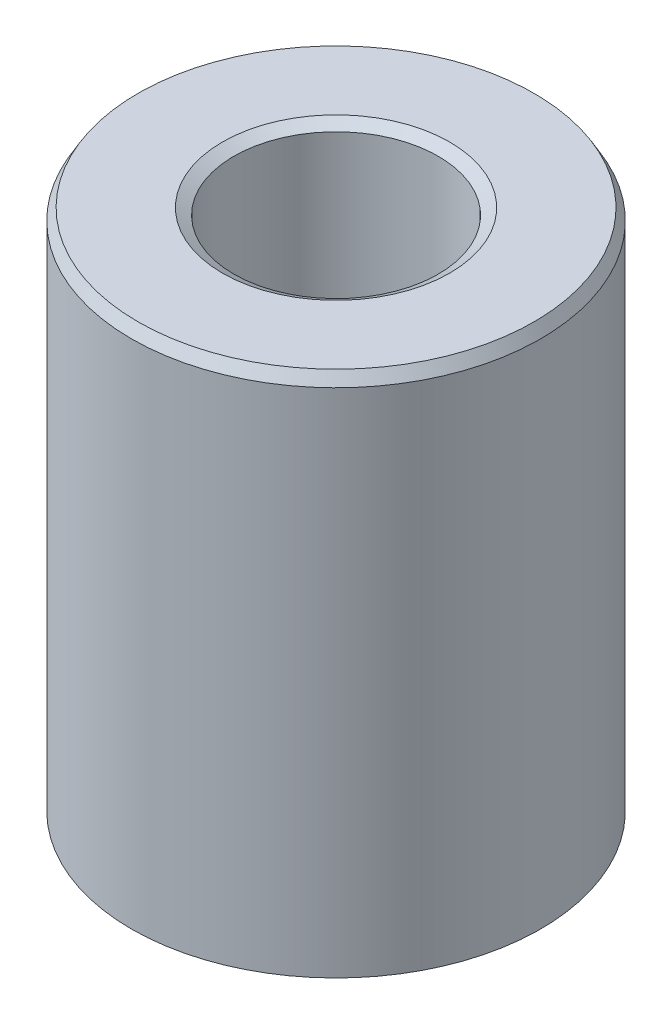
from build123d import *
from OCP.BRepFilletAPI import BRepFilletAPI_MakeChamfer

# Parameters (mm, degrees)
SKETCH1_R           = 57.5
BOSS_EXTRUDE1_DEPTH = 148.73445482
SKETCH2_R           = 28.723246382
CUT_EXTRUDE1_DEPTH  = 170.512353682
CHAMFER1_SIZE       = 3.209913636
CHAMFER1_SIZE2      = 1.853244502


with BuildPart() as part:
    # Sketch1 → Boss-Extrude1 (new body)
    with BuildSketch(Plane(origin=(0, 0, 0), x_dir=(1, 0, 0), z_dir=(0, 1, 0))):
        Circle(SKETCH1_R)
    extrude(amount=BOSS_EXTRUDE1_DEPTH)

    # Sketch2 → Cut-Extrude1 (cut, through all)
    with BuildSketch(Plane(origin=(0, 0, 0), x_dir=(1, 0, 0), z_dir=(0, 1, 0))):
        Circle(SKETCH2_R)
    extrude(amount=CUT_EXTRUDE1_DEPTH, mode=Mode.SUBTRACT)

    # Chamfer1: one chamfer whose edges measure the first distance from different faces: ONE call of the kernel's chamfer builder (chamfer() names one face for all edges)
    chamfer1_edges_1 = [part.edges().sort_by_distance(p)[0] for p in [
        (-28.723246382, 148.73445482, 0),
    ]]
    chamfer1_side_1 = [part.faces().sort_by_distance(p)[0] for p in [
        (-55.873654403, 148.73445482, 0),
    ]]
    chamfer1_edges_2 = [part.edges().sort_by_distance(p)[0] for p in [
        (-28.723246382, 0, 0),
    ]]
    chamfer1_side_2 = [part.faces().sort_by_distance(p)[0] for p in [
        (-28.723246382, 74.36722741, 0),
    ]]
    chamfer1_edges_3 = [part.edges().sort_by_distance(p)[0] for p in [
        (-57.5, 0, 0),
    ]]
    chamfer1_side_3 = [part.faces().sort_by_distance(p)[0] for p in [
        (-55.873654403, 0, 0),
    ]]
    chamfer1_edges_4 = [part.edges().sort_by_distance(p)[0] for p in [
        (-57.5, 148.73445482, 0),
    ]]
    chamfer1_side_4 = [part.faces().sort_by_distance(p)[0] for p in [
        (-57.5, 74.36722741, 0),
    ]]
    chamfer1 = BRepFilletAPI_MakeChamfer(part.part.solid().wrapped)
    for e in chamfer1_edges_1:
        chamfer1.Add(CHAMFER1_SIZE, CHAMFER1_SIZE2, e.wrapped, chamfer1_side_1[0].wrapped)  # the first distance lies on this face
    for e in chamfer1_edges_2:
        chamfer1.Add(CHAMFER1_SIZE, CHAMFER1_SIZE2, e.wrapped, chamfer1_side_2[0].wrapped)  # the first distance lies on this face
    for e in chamfer1_edges_3:
        chamfer1.Add(CHAMFER1_SIZE, CHAMFER1_SIZE2, e.wrapped, chamfer1_side_3[0].wrapped)  # the first distance lies on this face
    for e in chamfer1_edges_4:
        chamfer1.Add(CHAMFER1_SIZE, CHAMFER1_SIZE2, e.wrapped, chamfer1_side_4[0].wrapped)  # the first distance lies on this face
    add(Compound.cast(chamfer1.Shape()), mode=Mode.REPLACE)


solid = part.part
